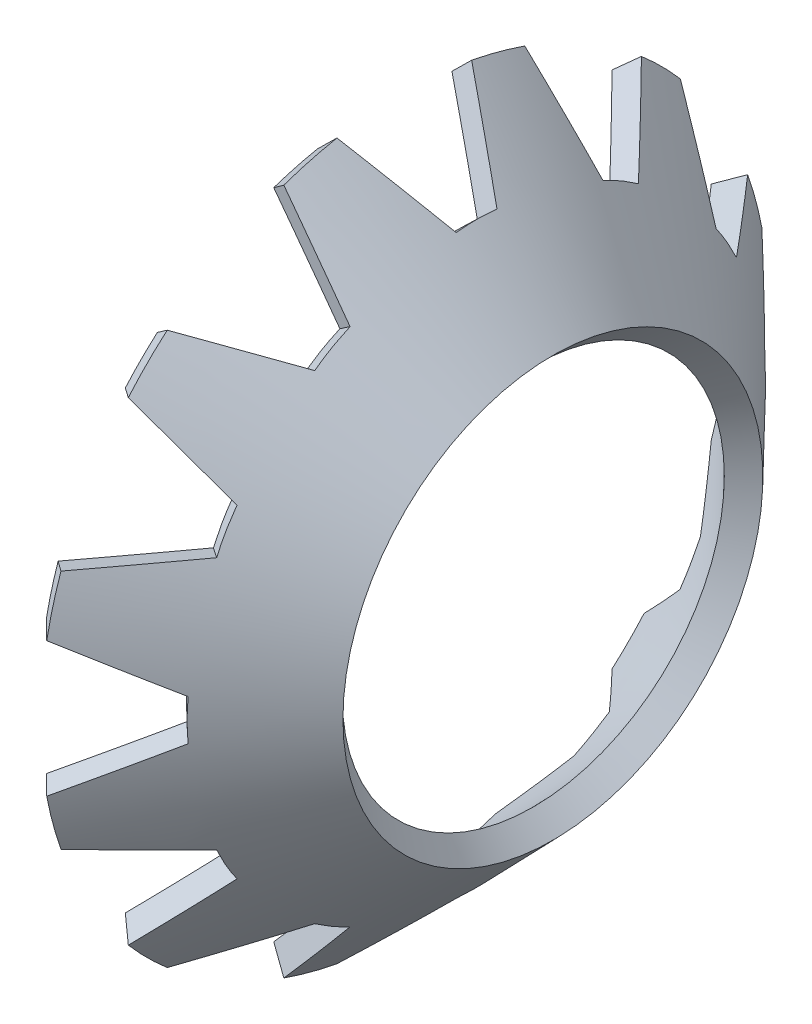
from build123d import *

# Parameters (mm, degrees)
EXTCUT_DEPTH  = 19.184446463
EXTCUTS_COUNT = 12
EXTCUTS_ANGLE = 330


with BuildPart() as part:
    # SecSke → Base-Revolve (revolve)
    with BuildSketch(Plane.XY):
        Polygon((-4.458387129, 4.616795022), (-7.725510198, 8), (-8.157114079, 7.583204978), (-4.889991009, 4.2), align=None)
    revolve(axis=Axis((-34.925, 0, 0), (1, 0, 0)))

    # ExtCutSke → ExtCut (cut, through all)
    with BuildSketch(Plane(origin=(-7.725510198, 8, 0), x_dir=(0, 0, 1), z_dir=(0.7193398003386475, 0.694658370459001, 0))):
        with BuildLine():
            Line((-0.448786028, 2.297632851), (-1.638758705, -0.238596355))
            ThreePointArc((-1.638758705, -0.238596355), (0, -0.4), (1.638758705, -0.238596355))
            Line((1.638758705, -0.238596355), (0.448786028, 2.297632851))
            ThreePointArc((0.448786028, 2.297632851), (0, 2.28), (-0.448786028, 2.297632851))
        make_face()
    extcut = extrude(amount=-EXTCUT_DEPTH, mode=Mode.SUBTRACT)

    # ExtCuts: ExtCut ×12 about axis
    extcuts_axis = Axis((-34.925, 0, 0), (1, 0, 0))
    for i in range(1, EXTCUTS_COUNT):
        add(extcut.rotate(extcuts_axis, i * EXTCUTS_ANGLE / (EXTCUTS_COUNT - 1)), mode=Mode.SUBTRACT)


solid = part.part
